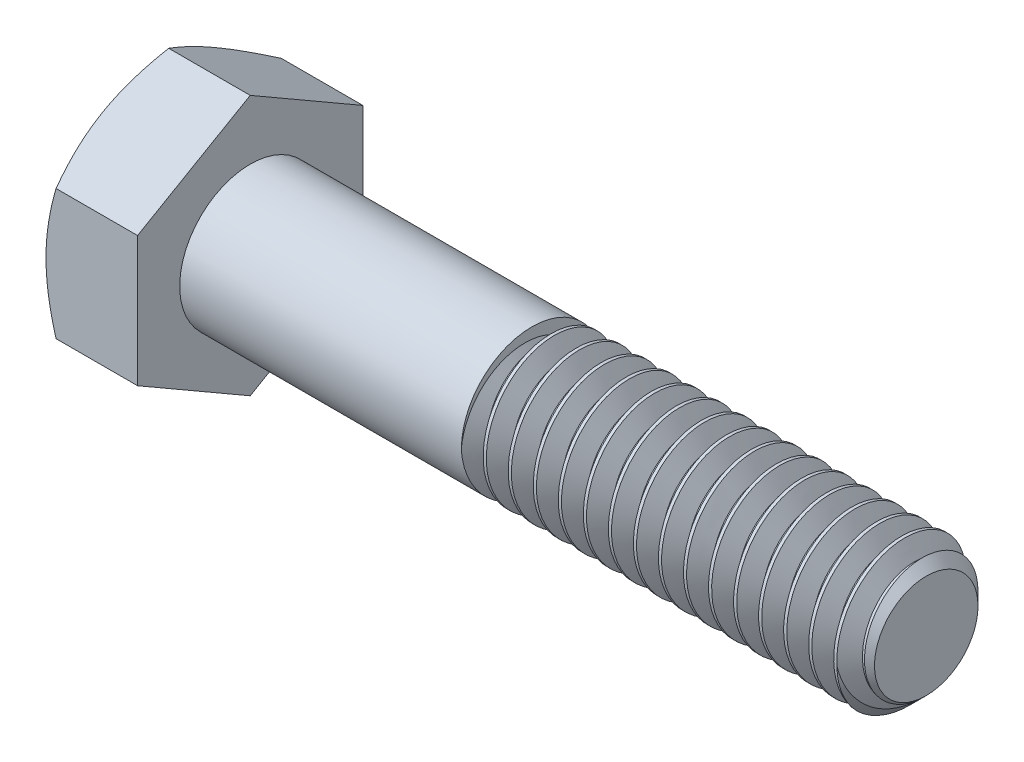
from build123d import *
from build123d.topology import SkipClean

# Parameters (mm, degrees)
SKETCH5_R           = 3.9751
BOSS_EXTRUDE3_DEPTH = 38.1
CHAMFER1_SIZE       = 1.058333333
BOSS_EXTRUDE4_DEPTH = 5.159375
SKETCH8_OUTSIDE_W   = 181.222
SKETCH8_OUTSIDE_H   = 183.186
SKETCH8_OUTSIDE_R   = 6.35
CUT_EXTRUDE3_DEPTH  = 45.333501539
CUT_EXTRUDE3_DRAFT  = -60
CUT_EXTRUDE4_DEPTH  = 0.254
CIRPATTERN1_COUNT   = 6
CUT_SWEEP2_PITCH    = 1.411111111
CUT_SWEEP2_TO       = 38.1
SKETCH14_R          = 3.9751
BOSS_EXTRUDE5_DEPTH = 15.875


with BuildPart() as part:
    # Sketch5 → Boss-Extrude3 (new body)
    with BuildSketch(Plane(origin=(21.6296875, 0, 0), x_dir=(0, 0, -1), z_dir=(1, 0, 0))):
        Circle(SKETCH5_R)
    extrude(amount=-BOSS_EXTRUDE3_DEPTH)

    # Chamfer1
    chamfer1_edges = [part.edges().sort_by_distance(p)[0] for p in [
        (21.6296875, 0, 3.9751),
    ]]
    chamfer(chamfer1_edges, length=CHAMFER1_SIZE)

    # Sketch6 → Boss-Extrude4 (add)
    with BuildSketch(Plane.ZY.offset(16.4703125)):
        Polygon((6.35, 3.666174209), (0, 7.332348419), (-6.35, 3.666174209), (-6.35, -3.666174209), (0, -7.332348419), (6.35, -3.666174209), align=None)
    extrude(amount=BOSS_EXTRUDE4_DEPTH)


with BuildPart() as cut_extrude3_tool:
    # Sketch8 outside → Cut-Extrude3 (with draft: the straight prism first)
    with BuildSketch(Plane.ZY.offset(21.6296875)):
        Rectangle(SKETCH8_OUTSIDE_W, SKETCH8_OUTSIDE_H)
        Circle(SKETCH8_OUTSIDE_R, mode=Mode.SUBTRACT)
    extrude(amount=-CUT_EXTRUDE3_DEPTH)
    # Cut-Extrude3: the draft: its side faces are tilted about the plane it starts from
    cut_extrude3_sides = [cut_extrude3_tool.faces().sort_by_distance(p)[0] for p in [
        (1.03706327, -91.593, 0),
        (1.03706327, 0, 90.611),
        (1.03706327, 91.593, 0),
        (1.03706327, 0, -90.611),
        (1.03706327, 0, -6.35),
    ]]
    draft(cut_extrude3_sides, Plane.ZY.offset(21.6296875), CUT_EXTRUDE3_DRAFT)


with BuildPart() as part_1:
    add(part.part)

    # Cut-Extrude3: cut by cut_extrude3_tool
    add(cut_extrude3_tool.part, mode=Mode.SUBTRACT)

    # Sketch12 → Cut-Extrude4 (cut)
    with BuildSketch(Plane.ZY.offset(21.6296875)):
        with BuildLine():
            Line((0.1905, 4.8895), (0.1905, 2.7305))
            ThreePointArc((0.1905, 2.7305), (0, 2.54), (-0.1905, 2.7305))
            Line((-0.1905, 2.7305), (-0.1905, 4.8895))
            ThreePointArc((-0.1905, 4.8895), (0, 5.08), (0.1905, 4.8895))
        make_face()
    cut_extrude4 = extrude(amount=-CUT_EXTRUDE4_DEPTH, mode=Mode.SUBTRACT)

    # CirPattern1: Cut-Extrude4 ×6 about axis
    cirpattern1_axis = Axis((0, 0, 0), (1, 0, 0))
    for i in range(1, CIRPATTERN1_COUNT):
        add(cut_extrude4.rotate(cirpattern1_axis, i * 360 / CIRPATTERN1_COUNT), mode=Mode.SUBTRACT)


with BuildPart() as body_2:
    # Split1: read off the stored shape, not the designer's step
    # Split1: the piece on the far side of the plane
    add(part_1.part)
    split(bisect_by=Plane.YZ.offset(-16.4703125), keep=Keep.BOTTOM)


with BuildPart() as part_2:
    add(part_1.part)

    # Split1
    split(bisect_by=Plane.YZ.offset(-16.4703125), keep=Keep.TOP)

    # Cut-Sweep2: arcs per turn and ends read off the stored shape
    # Cut-Sweep2: the profile of Sketch10 screwed along a right-hand helix through 28 turns, 8 arcs to a turn; built about Z, then put on its axis
    cut_sweep2_z = Axis((0, 0, 0), (0, 0, 1))
    cut_sweep2_corners = [(3.9751, 0, 0), (3.058556448, 0, -0.529166667), (3.058556448, 0, -0.705555556), (3.9751, 0, -1.234722222), (4.0005, 0, -1.249386919), (4.0005, 0, 0.014664697)]
    with BuildLine(mode=Mode.PRIVATE) as cut_sweep2_profile:
        Line(cut_sweep2_corners[0], cut_sweep2_corners[1])
        Line(cut_sweep2_corners[1], cut_sweep2_corners[2])
        Line(cut_sweep2_corners[2], cut_sweep2_corners[3])
        Line(cut_sweep2_corners[3], cut_sweep2_corners[4])
        Line(cut_sweep2_corners[4], cut_sweep2_corners[5])
        Line(cut_sweep2_corners[5], cut_sweep2_corners[0])
    cut_sweep2_cap = Face(cut_sweep2_profile.wire())
    cut_sweep2_turn_angles = [0, 22.5, 45, 67.5, 90, 112.5, 135, 157.5, 180, 202.5, 225, 247.5, 270, 292.5, 315, 337.5, 360]
    cut_sweep2_turn_weights = [1, 0.9238795325112867, 1, 0.9238795325112867, 1, 0.9238795325112867, 1, 0.9238795325112867, 1, 0.9238795325112867, 1, 0.9238795325112867, 1, 0.9238795325112867, 1, 0.9238795325112867, 1]
    cut_sweep2_turn_rails = [Edge.make_bspline([Vector(p[0], p[1], 0).rotate(cut_sweep2_z, cut_sweep2_turn_angles[k]) / cut_sweep2_turn_weights[k] + Vector(0, 0, p[2] + CUT_SWEEP2_PITCH * cut_sweep2_turn_angles[k] / 360) for k in range(17)], [0, 0, 0, 1, 1, 2, 2, 3, 3, 4, 4, 5, 5, 6, 6, 7, 7, 8, 8, 8], 2, cut_sweep2_turn_weights) for p in cut_sweep2_corners]
    cut_sweep2_turn_sides = [Face.make_surface_from_curves(cut_sweep2_turn_rails[p[0]], cut_sweep2_turn_rails[p[1]]) for p in [(0, 1), (1, 2), (2, 3), (3, 4), (4, 5), (5, 0)]]
    cut_sweep2 = Plane(origin=(21.6296875, 0, 0), x_dir=(0, 1, 0), z_dir=(-1, 0, 0)) * split(Solid(Shell([*[p.moved(Location((0, 0, CUT_SWEEP2_PITCH * i))) for i in range(28) for p in cut_sweep2_turn_sides], cut_sweep2_cap, cut_sweep2_cap.rotate(cut_sweep2_z, 10080).moved(Location((0, 0, CUT_SWEEP2_PITCH * 10080 / 360)))])), bisect_by=Plane.XY.offset(CUT_SWEEP2_TO), keep=Keep.BOTTOM, mode=Mode.PRIVATE)
    add(cut_sweep2, mode=Mode.SUBTRACT)

    with SkipClean():  # the faces are left unmerged after this step: merging them gives an invalid solid
        add(body_2.part)  # Boss-Extrude5 merges body 2
        # Sketch14 → Boss-Extrude5 (add)
        with BuildSketch(Plane(origin=(-16.4703125, 0, 0), x_dir=(0, 0, -1), z_dir=(1, 0, 0))):
            Circle(SKETCH14_R)
        extrude(amount=BOSS_EXTRUDE5_DEPTH)


solid = part_2.part
